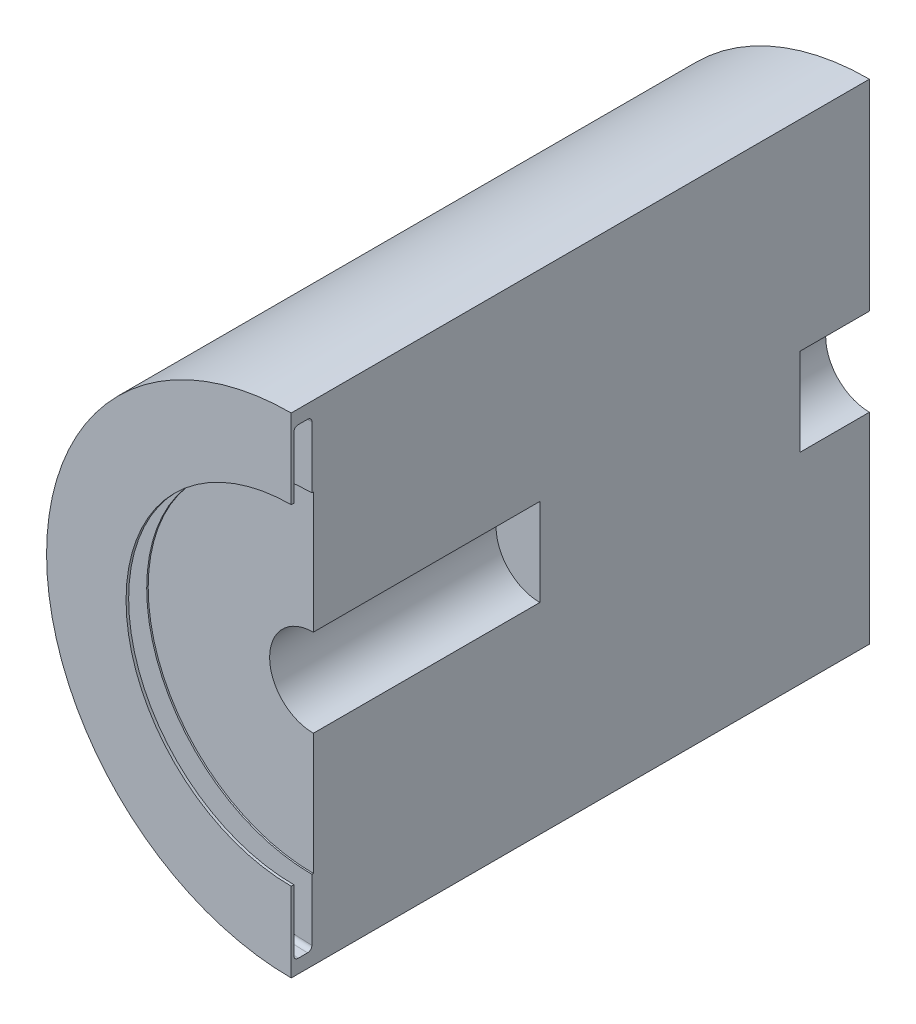
from build123d import *

# Parameters (mm, degrees)
REVOLVE1_ANGLE = 180


with BuildPart() as part:
    # Sketch4 → Revolve1 (revolve)
    with BuildSketch(Plane(origin=(13.6, 0, 0), x_dir=(0, 0, -1), z_dir=(1, 0, 0))):
        with BuildLine():
            Line((-55.68872263, 22.192187493), (-55.68872263, 16.172943098))
            Line((-55.68872263, 16.172943098), (-55.543361848, 16.172943098))
            Line((-55.543361848, 16.172943098), (-55.543361848, 4.284663725))
            Line((-55.543361848, 4.284663725), (-33.375659354, 4.284663725))
            Line((-33.375659354, 4.284663725), (-33.375659354, 0))
            Line((-33.375659354, 0), (-7.910834348, 0))
            Line((-7.910834348, 0), (-7.910834348, 4.284663725))
            Line((-7.910834348, 4.284663725), (-1.104206992, 4.284663725))
            Line((-1.104206992, 4.284663725), (-1.104206992, 23.071726667))
            Line((-1.104206992, 23.071726667), (-1.104206992, 23.953760321))
            Line((-1.104206992, 23.953760321), (-57.711066551, 23.953760321))
            Line((-57.711066551, 23.953760321), (-57.711066551, 23.071726667))
            Line((-57.711066551, 23.071726667), (-57.711066551, 16.172943098))
            Line((-57.711066551, 16.172943098), (-57.457020519, 16.172943098))
            Line((-57.457020519, 16.172943098), (-57.457020519, 22.199983477))
            ThreePointArc((-57.457020519, 22.199983477), (-57.323486009, 22.500785238), (-57.016054822, 22.618255363))
            Line((-57.016054822, 22.618255363), (-56.116054822, 22.618255363))
            ThreePointArc((-56.116054822, 22.618255363), (-55.813962243, 22.49391031), (-55.68872263, 22.192187493))
        make_face()
    revolve(axis=Axis((13.6, 0, 20), (0, 0, 1)), revolution_arc=REVOLVE1_ANGLE)


solid = part.part
